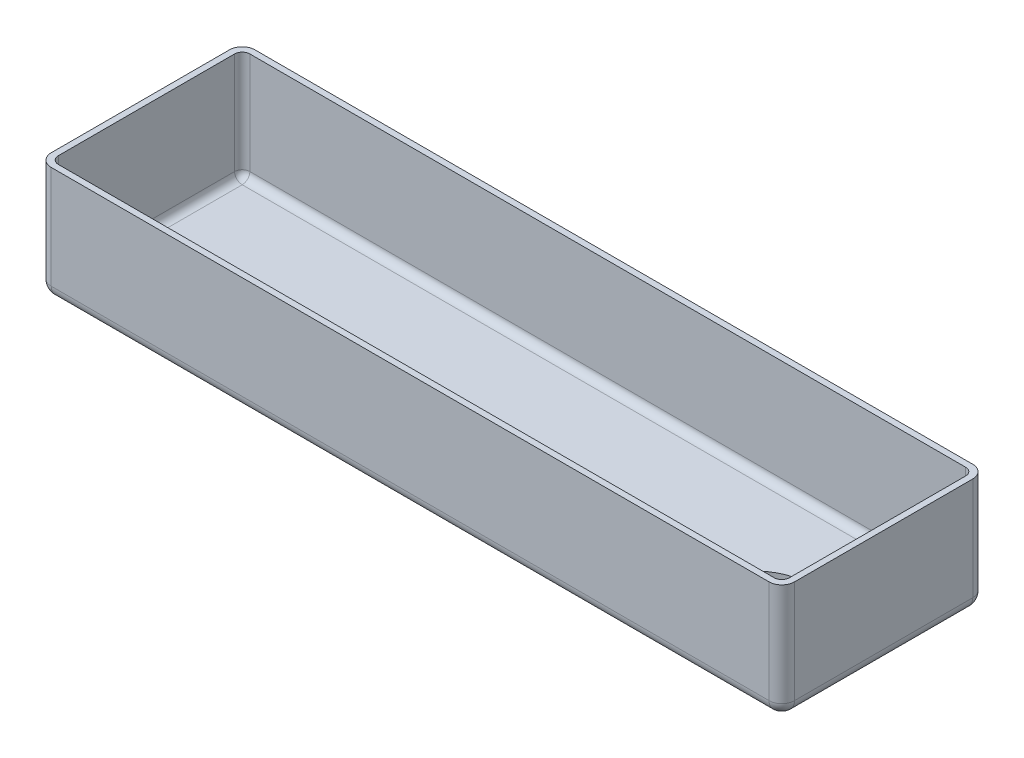
from build123d import *

# Parameters (mm, degrees)
SKETCH1_W           = 185.3692
SKETCH1_H           = 50.8
SKETCH1_W_2         = 182.3212
SKETCH1_H_2         = 47.752
BOSS_EXTRUDE1_DEPTH = 27.305
SKETCH2_W           = 185.3692
SKETCH2_H           = 50.8
BOSS_EXTRUDE2_DEPTH = 1.524
FILLET1_R           = 1.905
FILLET2_R           = 3.175
SKETCH4_R           = 12.7
CUT_EXTRUDE2_DEPTH  = 101.332977222


with BuildPart() as part:
    # Sketch1 → Boss-Extrude1 (new body)
    with BuildSketch(Plane(origin=(0, 0, 0), x_dir=(1, 0, 0), z_dir=(0, 1, 0))):
        Rectangle(SKETCH1_W, SKETCH1_H)
        Rectangle(SKETCH1_W_2, SKETCH1_H_2, mode=Mode.SUBTRACT)
    extrude(amount=BOSS_EXTRUDE1_DEPTH)

    # Sketch2 → Boss-Extrude2 (add)
    with BuildSketch(Plane.XZ):
        Rectangle(SKETCH2_W, SKETCH2_H)
    extrude(amount=BOSS_EXTRUDE2_DEPTH)

    # Fillet1
    fillet1_edges = [part.edges().sort_by_distance(p)[0] for p in [
        (91.1606, 13.6525, -23.876),
        (91.1606, 13.6525, 23.876),
        (-91.1606, 13.6525, 23.876),
        (-91.1606, 13.6525, -23.876),
        (91.1606, 0, 0),
        (0, 0, 23.876),
        (-91.1606, 0, 0),
        (0, 0, -23.876),
    ]]
    fillet(fillet1_edges, radius=FILLET1_R)

    # Fillet2
    fillet2_edges = [part.edges().sort_by_distance(p)[0] for p in [
        (-92.6846, -1.524, 0),
        (0, -1.524, 25.4),
        (92.6846, -1.524, 0),
        (0, -1.524, -25.4),
        (-92.6846, 12.8905, -25.4),
        (92.6846, 12.8905, -25.4),
        (92.6846, 12.8905, 25.4),
        (-92.6846, 12.8905, 25.4),
    ]]
    fillet(fillet2_edges, radius=FILLET2_R)

    # Sketch4 → Cut-Extrude2 (cut, through all)
    with BuildSketch(Plane.XZ.offset(1.524)):
        with Locations((67.2846, 6.35)):
            Circle(SKETCH4_R)
    extrude(amount=-CUT_EXTRUDE2_DEPTH, mode=Mode.SUBTRACT)


solid = part.part
